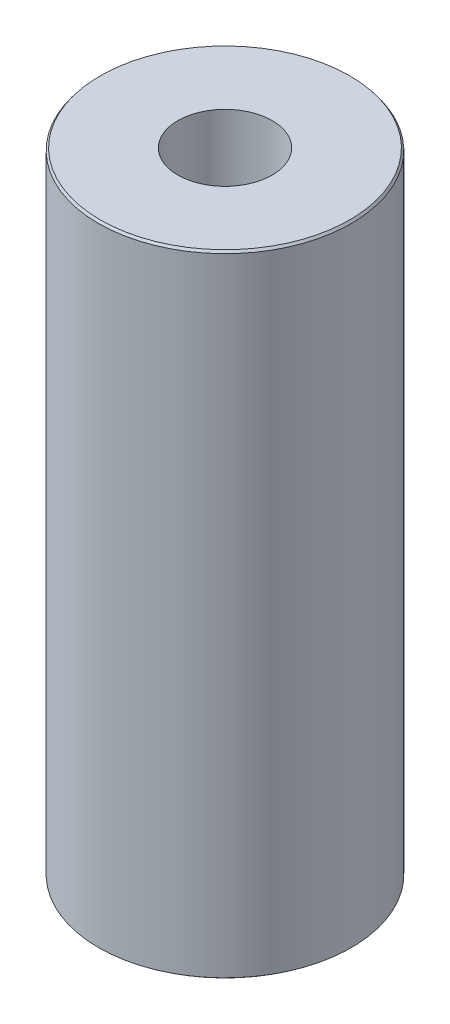
from build123d import *
from OCP.BRepFilletAPI import BRepFilletAPI_MakeChamfer

# Parameters (mm, degrees)
SKETCH1_R           = 45
BOSS_EXTRUDE1_DEPTH = 224.549064073
SKETCH2_R           = 16.792215779
CUT_EXTRUDE1_DEPTH  = 234.392977992
CHAMFER1_SIZE       = 0.800310888
CHAMFER1_SIZE2      = 0.606850371


with BuildPart() as part:
    # Sketch1 → Boss-Extrude1 (new body)
    with BuildSketch(Plane(origin=(0, 0, 0), x_dir=(1, 0, 0), z_dir=(0, 1, 0))):
        Circle(SKETCH1_R)
    extrude(amount=BOSS_EXTRUDE1_DEPTH)

    # Sketch2 → Cut-Extrude1 (cut, through all)
    with BuildSketch(Plane(origin=(0, 0, 0), x_dir=(1, 0, 0), z_dir=(0, 1, 0))):
        Circle(SKETCH2_R)
    extrude(amount=CUT_EXTRUDE1_DEPTH, mode=Mode.SUBTRACT)

    # Chamfer1: one chamfer whose edges measure the first distance from different faces: ONE call of the kernel's chamfer builder (chamfer() names one face for all edges)
    chamfer1_edges_1 = [part.edges().sort_by_distance(p)[0] for p in [
        (-45, 224.549064073, 0),
    ]]
    chamfer1_side_1 = [part.faces().sort_by_distance(p)[0] for p in [
        (-45, 112.274532036, 0),
    ]]
    chamfer1_edges_2 = [part.edges().sort_by_distance(p)[0] for p in [
        (-45, 0, 0),
    ]]
    chamfer1_side_2 = [part.faces().sort_by_distance(p)[0] for p in [
        (-43.727207794, 0, 0),
    ]]
    chamfer1 = BRepFilletAPI_MakeChamfer(part.part.solid().wrapped)
    for e in chamfer1_edges_1:
        chamfer1.Add(CHAMFER1_SIZE, CHAMFER1_SIZE2, e.wrapped, chamfer1_side_1[0].wrapped)  # the first distance lies on this face
    for e in chamfer1_edges_2:
        chamfer1.Add(CHAMFER1_SIZE, CHAMFER1_SIZE2, e.wrapped, chamfer1_side_2[0].wrapped)  # the first distance lies on this face
    add(Compound.cast(chamfer1.Shape()), mode=Mode.REPLACE)


solid = part.part
